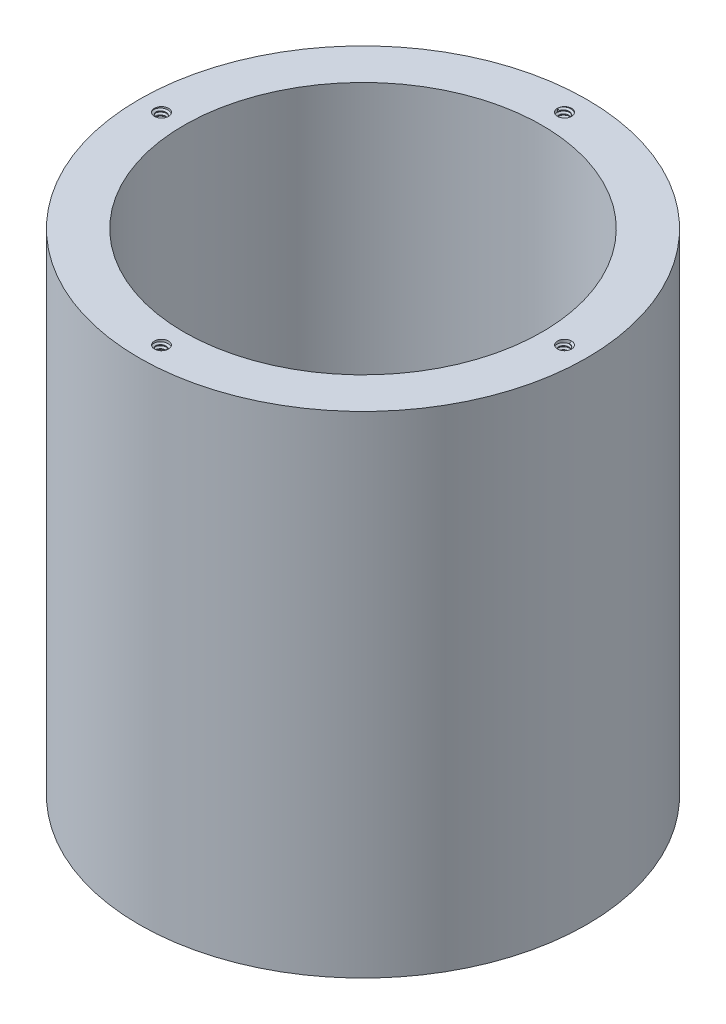
from build123d import *
from build123d.topology import SkipClean

# Parameters (mm, degrees)
SKETCH1_R           = 15.875
SKETCH1_R_2         = 12.7
BOSS_EXTRUDE1_DEPTH = 34.8
SKETCH2_R           = 0.5
CUT_EXTRUDE1_DEPTH  = 2
THREAD1_PITCH       = 0.25
CIRPATTERN1_COUNT   = 4
CUT_EXTRUDE2_START  = -2
SKETCH5_R           = 0.5
CUT_EXTRUDE2_DEPTH  = 2
THREAD2_PITCH       = 0.25
CIRPATTERN2_COUNT   = 4


with BuildPart() as part:
    # Sketch1 → Boss-Extrude1 (new body)
    with BuildSketch(Plane(origin=(0, 0, 0), x_dir=(1, 0, 0), z_dir=(0, 1, 0))):
        with Locations(Location((0, 0, 0), (0, 0, 270))):
            Circle(SKETCH1_R)
        with Locations(Location((0, 0, 0), (0, 0, 270))):
            Circle(SKETCH1_R_2, mode=Mode.SUBTRACT)
    extrude(amount=BOSS_EXTRUDE1_DEPTH)

    # Sketch2 → Cut-Extrude1 (cut)
    with BuildSketch(Plane(origin=(0, 34.8, 0), x_dir=(1, 0, 0), z_dir=(0, 1, 0))):
        with Locations(Location((0, 14.29, 0), (0, 0, 270))):
            Circle(SKETCH2_R)
    cut_extrude1 = extrude(amount=-CUT_EXTRUDE1_DEPTH, mode=Mode.SUBTRACT)

    # Thread1: the profile of Thread Profile1 profile screwed along a right-hand helix of 8 turns, 6 arcs to a turn; built about Z, then put on its axis
    with SkipClean():  # the faces are left unmerged after this step: merging them gives an invalid solid
        thread1_z = Axis((0, 0, 0), (0, 0, 1))
        thread1_corners = [(0.5003, 0, -0.000173205), (0.5003, 0, 0.218923204), (0.364683531, 0, 0.140625), (0.364683531, 0, 0.078125)]
        with BuildLine(mode=Mode.PRIVATE) as thread1_profile:
            Line(thread1_corners[0], thread1_corners[1])
            Line(thread1_corners[1], thread1_corners[2])
            Line(thread1_corners[2], thread1_corners[3])
            Line(thread1_corners[3], thread1_corners[0])
        thread1_cap = Face(thread1_profile.wire())
        thread1_turn_angles = [0, 30, 60, 90, 120, 150, 180, 210, 240, 270, 300, 330, 360]
        thread1_turn_weights = [1, 0.8660254037844387, 1, 0.8660254037844387, 1, 0.8660254037844387, 1, 0.8660254037844387, 1, 0.8660254037844387, 1, 0.8660254037844387, 1]
        thread1_turn_rails = [Edge.make_bspline([Vector(p[0], p[1], 0).rotate(thread1_z, thread1_turn_angles[k]) / thread1_turn_weights[k] + Vector(0, 0, p[2] + THREAD1_PITCH * thread1_turn_angles[k] / 360) for k in range(13)], [0, 0, 0, 1, 1, 2, 2, 3, 3, 4, 4, 5, 5, 6, 6, 6], 2, thread1_turn_weights) for p in thread1_corners]
        thread1_turn_sides = [Face.make_surface_from_curves(thread1_turn_rails[p[0]], thread1_turn_rails[p[1]]) for p in [(0, 1), (1, 2), (2, 3), (3, 0)]]
        thread1 = Plane(origin=(0, 34.8, -14.29), x_dir=(-1, 0, 0), z_dir=(0, -1, 0)) * Solid(Shell([*[p.moved(Location((0, 0, THREAD1_PITCH * i))) for i in range(8) for p in thread1_turn_sides], thread1_cap, thread1_cap.rotate(thread1_z, 2880).moved(Location((0, 0, THREAD1_PITCH * 2880 / 360)))]))
        add(thread1)

    # CirPattern1: Cut-Extrude1, Thread1 ×4 about axis
    with SkipClean():  # the faces are left unmerged after this step: merging them gives an invalid solid
        cirpattern1_axis = Axis((0, 34.8, 0), (0, 1, 0))
        add([cut_extrude1.rotate(cirpattern1_axis, i * 360 / CIRPATTERN1_COUNT) for i in range(1, CIRPATTERN1_COUNT)], mode=Mode.SUBTRACT)
        add([thread1.rotate(cirpattern1_axis, i * 360 / CIRPATTERN1_COUNT) for i in range(1, CIRPATTERN1_COUNT)])

    # Sketch5 → Cut-Extrude2 (cut)
    with SkipClean():  # the faces are left unmerged after this step: merging them gives an invalid solid
        with BuildSketch(Plane.XZ.offset(CUT_EXTRUDE2_START)):
            with Locations(Location((0, 14.29, 0), (0, 0, 270))):
                Circle(SKETCH5_R)
        cut_extrude2 = extrude(amount=CUT_EXTRUDE2_DEPTH, mode=Mode.SUBTRACT)

    # Thread2: the profile of Thread Profile2 profile screwed along a right-hand helix of 8 turns, 6 arcs to a turn; built about Z, then put on its axis
    with SkipClean():  # the faces are left unmerged after this step: merging them gives an invalid solid
        thread2_z = Axis((0, 0, 0), (0, 0, 1))
        thread2_corners = [(0.5003, 0, -0.000173205), (0.5003, 0, 0.218923204), (0.364683531, 0, 0.140625), (0.364683531, 0, 0.078125)]
        with BuildLine(mode=Mode.PRIVATE) as thread2_profile:
            Line(thread2_corners[0], thread2_corners[1])
            Line(thread2_corners[1], thread2_corners[2])
            Line(thread2_corners[2], thread2_corners[3])
            Line(thread2_corners[3], thread2_corners[0])
        thread2_cap = Face(thread2_profile.wire())
        thread2_turn_angles = [0, 30, 60, 90, 120, 150, 180, 210, 240, 270, 300, 330, 360]
        thread2_turn_weights = [1, 0.8660254037844387, 1, 0.8660254037844387, 1, 0.8660254037844387, 1, 0.8660254037844387, 1, 0.8660254037844387, 1, 0.8660254037844387, 1]
        thread2_turn_rails = [Edge.make_bspline([Vector(p[0], p[1], 0).rotate(thread2_z, thread2_turn_angles[k]) / thread2_turn_weights[k] + Vector(0, 0, p[2] + THREAD2_PITCH * thread2_turn_angles[k] / 360) for k in range(13)], [0, 0, 0, 1, 1, 2, 2, 3, 3, 4, 4, 5, 5, 6, 6, 6], 2, thread2_turn_weights) for p in thread2_corners]
        thread2_turn_sides = [Face.make_surface_from_curves(thread2_turn_rails[p[0]], thread2_turn_rails[p[1]]) for p in [(0, 1), (1, 2), (2, 3), (3, 0)]]
        thread2 = Plane(origin=(0, 0, 14.29), x_dir=(1, 0, 0), z_dir=(0, 1, 0)) * Solid(Shell([*[p.moved(Location((0, 0, THREAD2_PITCH * i))) for i in range(8) for p in thread2_turn_sides], thread2_cap, thread2_cap.rotate(thread2_z, 2880).moved(Location((0, 0, THREAD2_PITCH * 2880 / 360)))]))
        add(thread2)

    # CirPattern2: Cut-Extrude2, Thread2 ×4 about axis
    with SkipClean():  # the faces are left unmerged after this step: merging them gives an invalid solid
        cirpattern2_axis = Axis((0, 0, 0), (0, 1, 0))
        add([cut_extrude2.rotate(cirpattern2_axis, i * 360 / CIRPATTERN2_COUNT) for i in range(1, CIRPATTERN2_COUNT)], mode=Mode.SUBTRACT)
        add([thread2.rotate(cirpattern2_axis, i * 360 / CIRPATTERN2_COUNT) for i in range(1, CIRPATTERN2_COUNT)])


solid = part.part
